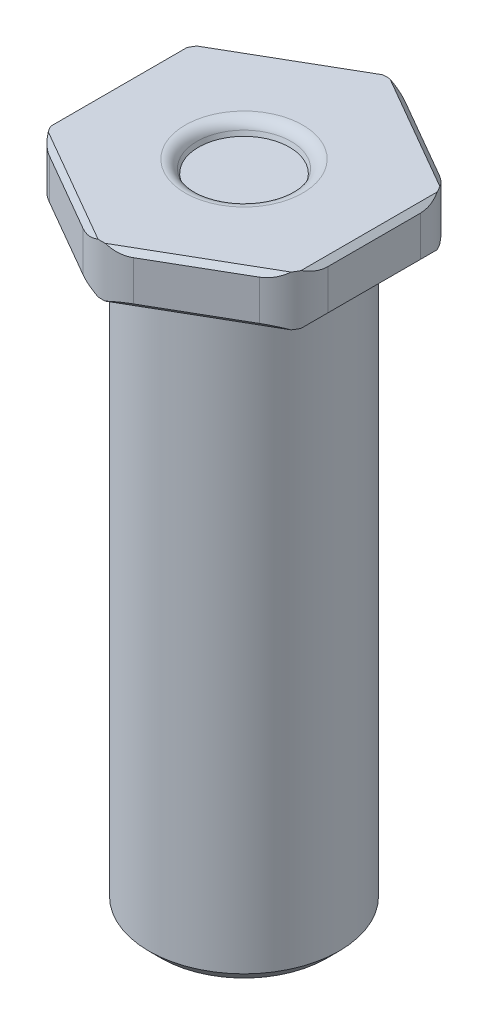
from build123d import *

# Parameters (mm, degrees)
SKETCH2_R           = 9.652
BOSS_EXTRUDE1_DEPTH = 63.5
CHAMFER1_SIZE       = 1.27
BOSS_EXTRUDE2_DEPTH = 2.54
CHAMFER2_SIZE       = 0.508
FILLET1_R           = 5.08
SKETCH7_R           = 5.08
CUT_EXTRUDE1_DEPTH  = 1.27
CUT_EXTRUDE1_DRAFT  = -20
FILLET2_R           = 1.27


with BuildPart() as part:
    # Sketch2 → Boss-Extrude1 (new body)
    with BuildSketch(Plane(origin=(0, 0, 0), x_dir=(1, 0, 0), z_dir=(0, 1, 0))):
        with Locations(Location((0, 0, 0), (0, 0, 270))):
            Circle(SKETCH2_R)
    extrude(amount=BOSS_EXTRUDE1_DEPTH)

    # Chamfer1
    chamfer1_edges = [part.edges().sort_by_distance(p)[0] for p in [
        (0, 0, -9.652),
    ]]
    chamfer(chamfer1_edges, length=CHAMFER1_SIZE)

    # Sketch6 → Boss-Extrude2 (add, symmetric)
    with BuildSketch(Plane(origin=(0, 63.5, 0), x_dir=(1, 0, 0), z_dir=(0, 1, 0))):
        Polygon((0, 15.24), (-13.198227154, 7.62), (-13.198227154, -7.62), (0, -15.24), (13.198227154, -7.62), (13.198227154, 7.62), align=None)
    extrude(amount=BOSS_EXTRUDE2_DEPTH, both=True)

    # Chamfer2
    chamfer2_edges = [part.edges().sort_by_distance(p)[0] for p in [
        (-13.198227154, 60.96, 0),
        (-6.599113577, 60.96, 11.43),
        (6.599113577, 60.96, 11.43),
        (13.198227154, 60.96, 0),
        (6.599113577, 66.04, -11.43),
        (-6.599113577, 66.04, -11.43),
        (-13.198227154, 66.04, 0),
        (-6.599113577, 66.04, 11.43),
        (6.599113577, 66.04, 11.43),
        (13.198227154, 66.04, 0),
        (6.599113577, 60.96, -11.43),
        (-6.599113577, 60.96, -11.43),
    ]]
    chamfer(chamfer2_edges, length=CHAMFER2_SIZE)

    # Fillet1
    # the kernel refuses this fillet: 5.08 mm, written as the material it takes off along each edge
    with BuildSketch(Plane(origin=(-13.198227154, 54.135651581, -7.62), x_dir=(0, 0, 1), z_dir=(0, 1, 0)), Plane(origin=(13.198227154, 72.864348419, 7.62), x_dir=(-0.8660254037844387, 0, 0.5), z_dir=(0, -1, 0))) as fillet1_piece_1:
        with BuildLine():
            CenterArc((FILLET1_R * 0.57735026919, FILLET1_R), FILLET1_R, 210, 60)
            Line((-FILLET1_R * 0.288675134595, FILLET1_R * 0.5), (0, 0))
            Line((0, 0), (FILLET1_R * 0.57735026919, 0))
        make_face()
    extrude(amount=18.728696837, mode=Mode.SUBTRACT)
    with BuildSketch(Plane(origin=(-13.198227154, 54.135651581, 7.62), x_dir=(0, 0, -1), z_dir=(0, 1, 0)), Plane(origin=(0, 72.864348419, -15.24), x_dir=(-0.8660254037844386, 0, 0.5), z_dir=(0, -1, 0)), Plane(origin=(13.198227154, 72.864348419, -7.62), x_dir=(-0.8660254037844388, 0, -0.4999999999999998), z_dir=(0, -1, 0)), Plane(origin=(0, 54.135651581, 15.24), x_dir=(-0.8660254037844386, 0, -0.5000000000000001), z_dir=(0, 1, 0))) as fillet1_piece_2:
        with BuildLine():
            CenterArc((FILLET1_R * 0.57735026919, -FILLET1_R), FILLET1_R, 90, 60)
            Line((-FILLET1_R * 0.288675134595, -FILLET1_R * 0.5), (0, 0))
            Line((0, 0), (FILLET1_R * 0.57735026919, 0))
        make_face()
    extrude(amount=18.728696837, mode=Mode.SUBTRACT)


with BuildPart() as cut_extrude1_tool:
    # Sketch7 → Cut-Extrude1 (with draft: the straight prism first)
    with BuildSketch(Plane(origin=(0, 66.04, 0), x_dir=(1, 0, 0), z_dir=(0, 1, 0))):
        Circle(SKETCH7_R)
    extrude(amount=-CUT_EXTRUDE1_DEPTH)
    # Cut-Extrude1: the draft: its side faces are tilted about the plane it starts from
    cut_extrude1_sides = [cut_extrude1_tool.faces().sort_by_distance(p)[0] for p in [
        (-5.08, 65.405, 0),
    ]]
    draft(cut_extrude1_sides, Plane(origin=(0, 66.04, 0), x_dir=(1, 0, 0), z_dir=(0, 1, 0)), CUT_EXTRUDE1_DRAFT)


with BuildPart() as part_1:
    add(part.part)

    # Cut-Extrude1: cut by cut_extrude1_tool
    add(cut_extrude1_tool.part, mode=Mode.SUBTRACT)

    # Fillet2
    fillet2_edges = [part_1.edges().sort_by_distance(p)[0] for p in [
        (-5.08, 66.04, 0),
    ]]
    fillet(fillet2_edges, radius=FILLET2_R)


solid = part_1.part
